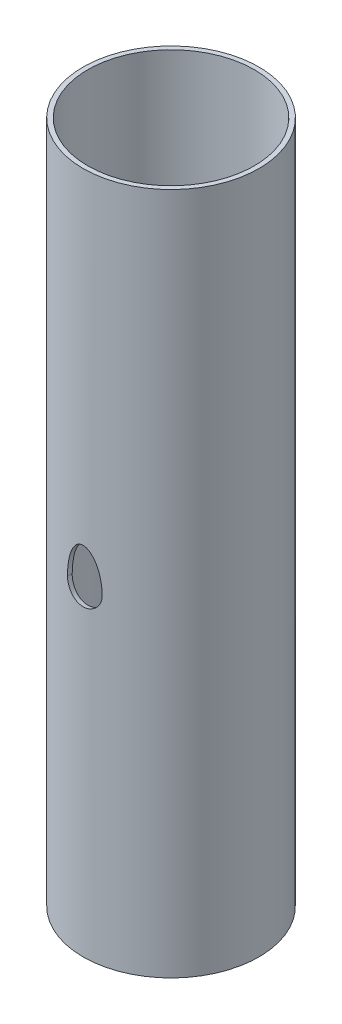
from build123d import *

# Parameters (mm, degrees)
SKETCH2_R           = 38
SKETCH2_R_2         = 36
BOSS_EXTRUDE1_DEPTH = 295
CUT_EXTRUDE1_REACH  = 301.855


with BuildPart() as part:
    # Sketch2 → Boss-Extrude1 (new body)
    with BuildSketch(Plane(origin=(0, 0, 0), x_dir=(1, 0, 0), z_dir=(0, 1, 0))):
        Circle(SKETCH2_R)
        Circle(SKETCH2_R_2, mode=Mode.SUBTRACT)
    extrude(amount=BOSS_EXTRUDE1_DEPTH)

    # Sketch3 → Cut-Extrude1 (cut, up to next)
    with BuildSketch(Plane(origin=(0, 0, 0), x_dir=(-1, 0, 0), z_dir=(0, 0.20449605184179045, 0.978867388761685)), mode=Mode.PRIVATE) as cut_extrude1_sk1:
        with BuildLine():
            ThreePointArc((7.5, -128), (0, -120.5), (-7.5, -128))
            add(Edge.make_bspline(
                [(-7.5, -128), (-7.5, -143), (0, -143), (7.5, -143), (7.5, -128)],
                knots=[4.71238898, 4.71238898, 4.71238898, 6.283185307, 6.283185307, 7.853981634, 7.853981634, 7.853981634], degree=2, weights=[1, 0.707106781, 1, 0.707106781, 1]))
        make_face()
    cut_extrude1_tool1 = extrude(cut_extrude1_sk1.sketch, amount=CUT_EXTRUDE1_REACH, mode=Mode.PRIVATE) & part.part
    add(cut_extrude1_tool1.solids().sort_by_distance((0, 128.409741, -26.826193))[0], mode=Mode.SUBTRACT)


solid = part.part
